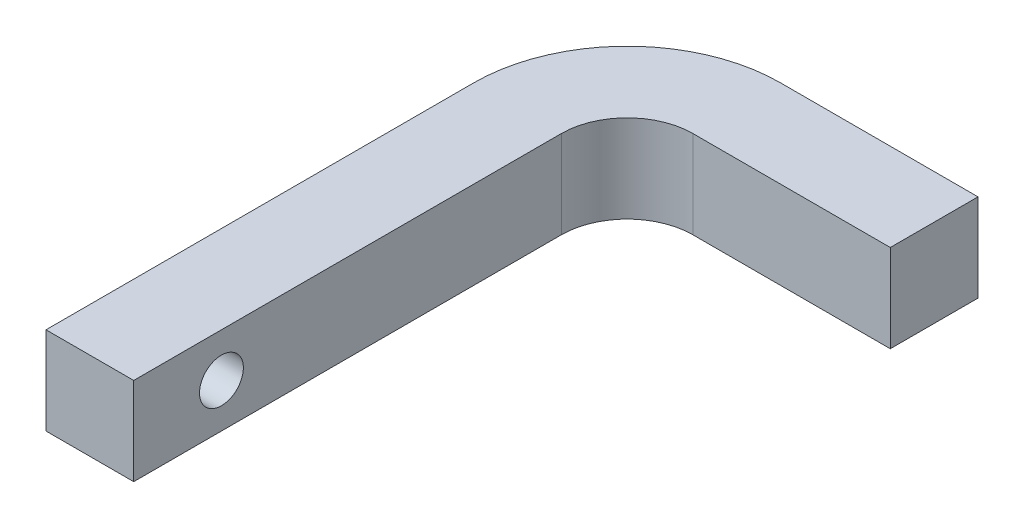
from build123d import *

# Parameters (mm, degrees)
BOSS_EXTRUDE1_DEPTH      = 4
BOSS_EXTRUDE1_DEPTH_BACK = 4
CUT_EXTRUDE1_DEPTH       = 59.318093247
CUT_EXTRUDE1_DEPTH_BACK  = 59.318093247
SKETCH2_R                = 2


with BuildPart() as part:
    # Sketch1 → Boss-Extrude1 (new, two sides: drawn at the far end of the back side and taken through both)
    with BuildSketch(Plane(origin=(0, 0, 0), x_dir=(1, 0, 0), z_dir=(0, 1, 0)).offset(-BOSS_EXTRUDE1_DEPTH_BACK)):
        with BuildLine():
            Line((-9, 0), (9, 0))
            Line((9, 0), (9, -8))
            Line((9, -8), (-9, -8))
            ThreePointArc((-9, -8), (-13.242640687, -9.757359313), (-15, -14))
            Line((-15, -14), (-15, -53))
            Line((-15, -53), (-23, -53))
            Line((-23, -53), (-23, -14))
            ThreePointArc((-23, -14), (-18.899494937, -4.100505063), (-9, 0))
        make_face()
    extrude(amount=BOSS_EXTRUDE1_DEPTH + BOSS_EXTRUDE1_DEPTH_BACK)

    # Sketch2 → Cut-Extrude1 (cut, two sides: drawn at the far end of the back side and taken through both)
    with BuildSketch(Plane.ZY.offset(15).offset(-CUT_EXTRUDE1_DEPTH_BACK)):
        with Locations((45, 0)):
            Circle(SKETCH2_R)
    extrude(amount=CUT_EXTRUDE1_DEPTH + CUT_EXTRUDE1_DEPTH_BACK, mode=Mode.SUBTRACT)


solid = part.part
